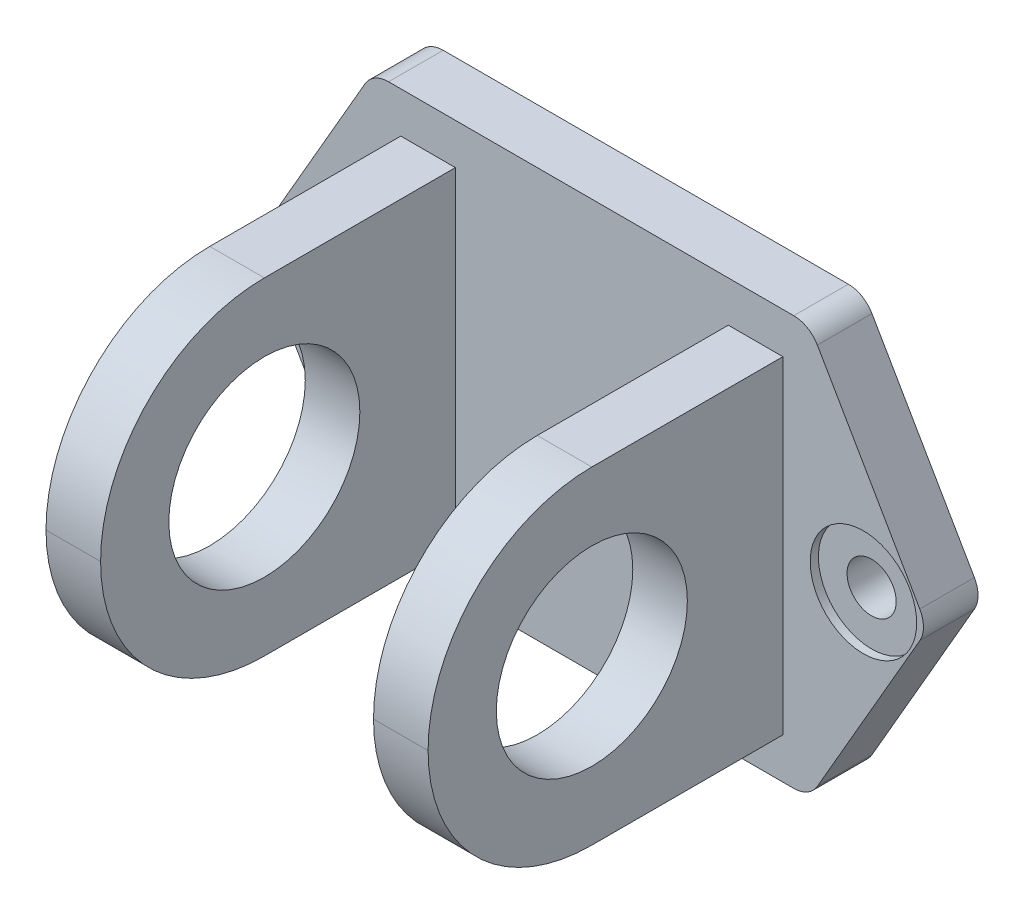
from build123d import *

# Parameters (mm, degrees)
BOSS_EXTRU_1_DEPTH      = 20
CONG_1_R                = 10
CONG_2_R                = 10
CONG_3_R                = 10
CONG_4_R                = 10
CONG_5_R                = 10
CONG_7_R                = 10
ESQUISSE2_W             = 20
ESQUISSE2_H             = 120
BOSS_EXTRU_2_DEPTH      = 130
CONG_8_R                = 60
CONG_9_R                = 60
CONG_10_R               = 60
CONG_11_R               = 60
ESQUISSE3_R             = 35
ENL_V_MAT_EXTRU_1_DEPTH = 258.77353424
ESQUISSE4_R             = 9
ENL_V_MAT_EXTRU_2_DEPTH = 335.555805948
ESQUISSE5_R             = 19.375511008
ESQUISSE5_R_2           = 19.500884668
ENL_V_MAT_EXTRU_3_DEPTH = 3


with BuildPart() as part:
    # Esquisse1 → Boss.-Extru.1 (new body)
    with BuildSketch(Plane.XY):
        Polygon((-254.799934421, 65.838280942), (-298.101203362, -9.161719058), (-254.799931925, -84.161719058), (-94.799931925, -84.161719058), (-51.498662984, -9.161719058), (-94.799934421, 65.838280942), align=None)
    extrude(amount=BOSS_EXTRU_1_DEPTH)

    # Congé1
    cong_1_edges = [part.edges().sort_by_distance(p)[0] for p in [
        (-94.799934421, 65.838280942, 10),
    ]]
    fillet(cong_1_edges, radius=CONG_1_R)

    # Congé2
    cong_2_edges = [part.edges().sort_by_distance(p)[0] for p in [
        (-254.799934421, 65.838280942, 10),
    ]]
    fillet(cong_2_edges, radius=CONG_2_R)

    # Congé3
    cong_3_edges = [part.edges().sort_by_distance(p)[0] for p in [
        (-298.101203362, -9.161719058, 10),
    ]]
    fillet(cong_3_edges, radius=CONG_3_R)

    # Congé4
    cong_4_edges = [part.edges().sort_by_distance(p)[0] for p in [
        (-254.799931925, -84.161719058, 10),
    ]]
    fillet(cong_4_edges, radius=CONG_4_R)

    # Congé5
    cong_5_edges = [part.edges().sort_by_distance(p)[0] for p in [
        (-94.799931925, -84.161719058, 10),
    ]]
    fillet(cong_5_edges, radius=CONG_5_R)

    # Congé7
    cong_7_edges = [part.edges().sort_by_distance(p)[0] for p in [
        (-51.498662984, -9.161719058, 10),
    ]]
    fillet(cong_7_edges, radius=CONG_7_R)

    # Esquisse2 → Boss.-Extru.2 (add)
    with BuildSketch(Plane.XY.offset(20)):
        with Locations((-234.554197979, -9.161719058)):
            Rectangle(ESQUISSE2_W, ESQUISSE2_H)
        with Locations((-114.554197979, -9.161719058)):
            Rectangle(ESQUISSE2_W, ESQUISSE2_H)
    extrude(amount=BOSS_EXTRU_2_DEPTH)

    # Congé8
    cong_8_edges = [part.edges().sort_by_distance(p)[0] for p in [
        (-114.554197979, -69.161719058, 150),
    ]]
    fillet(cong_8_edges, radius=CONG_8_R)

    # Congé9
    cong_9_edges = [part.edges().sort_by_distance(p)[0] for p in [
        (-114.554197979, 50.838280942, 150),
    ]]
    fillet(cong_9_edges, radius=CONG_9_R - 0.0001)  # a hair under: the kernel refuses the full size

    # Congé10
    cong_10_edges = [part.edges().sort_by_distance(p)[0] for p in [
        (-234.554197979, -69.161719058, 150),
    ]]
    fillet(cong_10_edges, radius=CONG_10_R)

    # Congé11
    cong_11_edges = [part.edges().sort_by_distance(p)[0] for p in [
        (-234.554197979, 50.838280942, 150),
    ]]
    fillet(cong_11_edges, radius=CONG_11_R - 0.0001)  # a hair under: the kernel refuses the full size

    # Esquisse3 → Enlèv. mat.-Extru.1 (cut, through all)
    with BuildSketch(Plane(origin=(-104.554197979, 0, 0), x_dir=(0, 0, -1), z_dir=(1, 0, 0))):
        with Locations(Location((-90, -9.161719058, 0), (0, 0, 90))):
            Circle(ESQUISSE3_R)
    extrude(amount=-ENL_V_MAT_EXTRU_1_DEPTH, mode=Mode.SUBTRACT)

    # Esquisse4 → Enlèv. mat.-Extru.2 (cut, through all)
    with BuildSketch(Plane.XY.offset(20)):
        with Locations((-274.554197979, -9.161719058)):
            Circle(ESQUISSE4_R)
        with Locations((-75.045668368, -9.161719084)):
            Circle(ESQUISSE4_R)
    extrude(amount=-ENL_V_MAT_EXTRU_2_DEPTH, mode=Mode.SUBTRACT)

    # Esquisse5 → Enlèv. mat.-Extru.3 (cut)
    with BuildSketch(Plane.XY.offset(20)):
        with Locations((-274.554197979, -9.161719058)):
            Circle(ESQUISSE5_R)
        with Locations((-75.045668368, -9.161719084)):
            Circle(ESQUISSE5_R_2)
    extrude(amount=-ENL_V_MAT_EXTRU_3_DEPTH, mode=Mode.SUBTRACT)


solid = part.part
